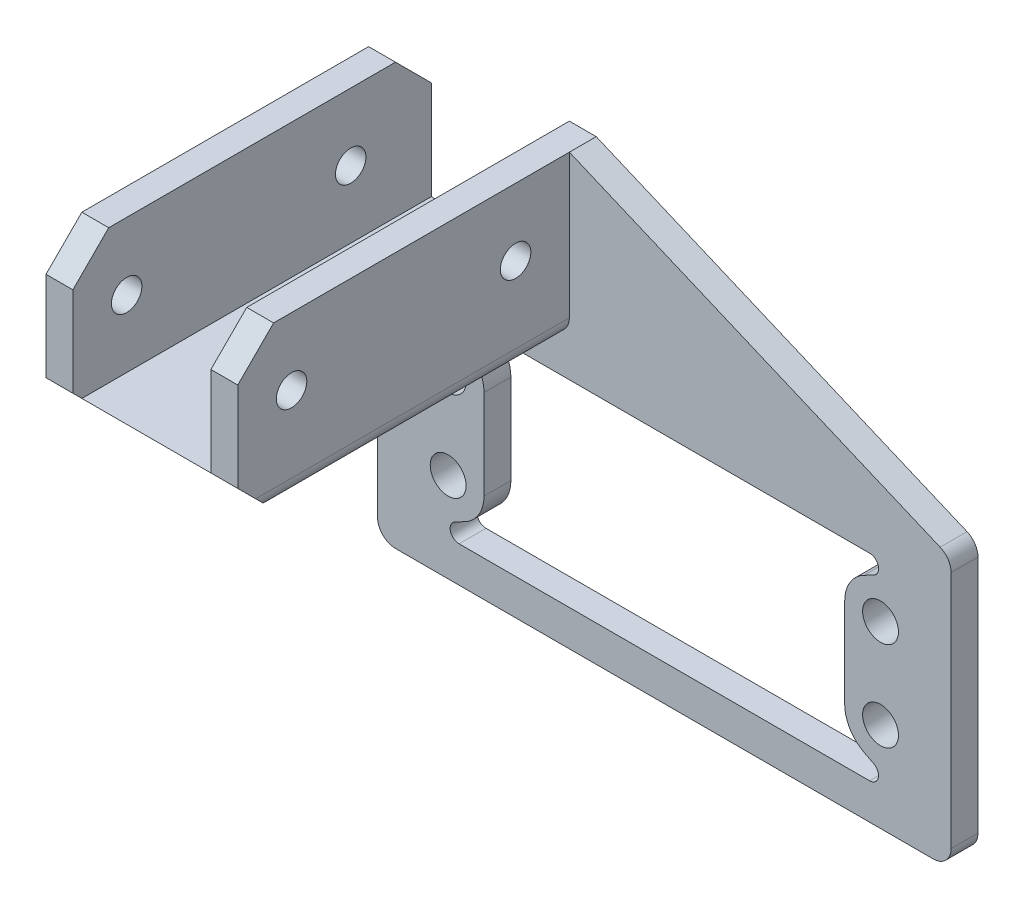
from build123d import *

# Parameters (mm, degrees)
BOSS_EXTRUDE1_DEPTH     = 40
CUT_EXTRUDE1_DEPTH      = 20
CUT_EXTRUDE1_DEPTH_BACK = 20
SKETCH2_R               = 1.7
BOSS_EXTRUDE2_START     = -3
SKETCH4_W               = 64
SKETCH4_H               = 30
SKETCH4_R               = 2
BOSS_EXTRUDE2_DEPTH     = 3
FILLET1_R               = 1
BOSS_EXTRUDE3_START     = -3
BOSS_EXTRUDE3_DEPTH     = 3
FILLET2_R               = 2
BOSS_EXTRUDE4_START     = -2
BOSS_EXTRUDE4_DEPTH     = 2
CHAMFER1_SIZE           = 4
CHAMFER3_SIZE           = 4
FILLET3_R               = 2


with BuildPart() as part:
    # Sketch1 → Boss-Extrude1 (new body)
    with BuildSketch(Plane.XY):
        Polygon((-3, -3), (-3, 15), (0, 15), (0, 0), (15.4, 0), (15.4, 15), (18.4, 15), (18.4, -3), align=None)
    extrude(amount=BOSS_EXTRUDE1_DEPTH)

    # Sketch2 → Cut-Extrude1 (cut, two sides: drawn at the far end of the back side and taken through both)
    with BuildSketch(Plane(origin=(0, 0, 0), x_dir=(0, 0, -1), z_dir=(1, 0, 0)).offset(-CUT_EXTRUDE1_DEPTH_BACK)):
        with Locations(Location((-34, 7.5, 0), (0, 0, 180))):
            Circle(SKETCH2_R)
        with Locations(Location((-9, 7.5, 0), (0, 0, 180))):
            Circle(SKETCH2_R)
    extrude(amount=CUT_EXTRUDE1_DEPTH + CUT_EXTRUDE1_DEPTH_BACK, mode=Mode.SUBTRACT)

    # Sketch4 → Boss-Extrude2 (add)
    with BuildSketch(Plane(origin=(0, 0, 0), x_dir=(-1, 0, 0), z_dir=(0, 0, -1)).offset(BOSS_EXTRUDE2_START)):
        with Locations((-29, -18)):
            Rectangle(SKETCH4_W, SKETCH4_H)
        with Locations((-4.875030798, -23.000128049)):
            Circle(SKETCH4_R, mode=Mode.SUBTRACT)
        with Locations((-4.87501026, -12.999951056)):
            Circle(SKETCH4_R, mode=Mode.SUBTRACT)
        with Locations((-53.124974567, -23.00004902)):
            Circle(SKETCH4_R, mode=Mode.SUBTRACT)
        with Locations((-53.125010259, -12.999787804)):
            Circle(SKETCH4_R, mode=Mode.SUBTRACT)
        with BuildLine():
            Line((-1.999964331, -28.999999992), (-55.999999981, -28.997992053))
            Line((-55.999999981, -28.997992053), (-51.282852208, -26.550624356))
            ThreePointArc((-51.282852208, -26.550624356), (-49.706744703, -25.077476419), (-49.124974567, -23.00004902))
            Line((-49.124974567, -23.00004902), (-49.125010259, -12.999787804))
            ThreePointArc((-49.125010259, -12.999787804), (-49.706039872, -10.923579364), (-51.280331003, -9.450540216))
            Line((-51.280331003, -9.450540216), (-55.999146244, -6.99799207))
            Line((-55.999146244, -6.99799207), (-1.999146282, -7.000000007))
            Line((-1.999146282, -7.000000007), (-6.718065019, -9.449859627))
            ThreePointArc((-6.718065019, -9.449859627), (-8.293505472, -10.922960328), (-8.87501026, -12.999951056))
            Line((-8.87501026, -12.999951056), (-8.875030798, -23.000128049))
            ThreePointArc((-8.875030798, -23.000128049), (-8.293584076, -25.077023205), (-6.718284054, -26.550116421))
            Line((-6.718284054, -26.550116421), (-1.999964331, -28.999999992))
        make_face(mode=Mode.SUBTRACT)
    extrude(amount=BOSS_EXTRUDE2_DEPTH)

    # Fillet1
    fillet1_edges = [part.edges().sort_by_distance(p)[0] for p in [
        (55.999999981, -28.997992053, 1.5),
        (1.999964331, -28.999999992, 1.5),
        (1.999146282, -7.000000007, 1.5),
        (55.999146244, -6.99799207, 1.5),
    ]]
    fillet(fillet1_edges, radius=FILLET1_R)

    # Sketch6 → Boss-Extrude3 (add)
    with BuildSketch(Plane(origin=(0, 0, 0), x_dir=(-1, 0, 0), z_dir=(0, 0, -1)).offset(BOSS_EXTRUDE3_START)):
        Polygon((-18.4, 15), (-61, -3), (-18.4, -3), align=None)
    extrude(amount=BOSS_EXTRUDE3_DEPTH)

    # Fillet2
    fillet2_edges = [part.edges().sort_by_distance(p)[0] for p in [
        (61, -3, 1.5),
        (-3, -33, 1.5),
        (61, -33, 1.5),
    ]]
    fillet(fillet2_edges, radius=FILLET2_R)

    # Sketch7 → Boss-Extrude4 (add)
    with BuildSketch(Plane.ZY.offset(3).offset(BOSS_EXTRUDE4_START)):
        Polygon((3, -17), (14.5, -3), (3, -3), align=None)
    extrude(amount=BOSS_EXTRUDE4_DEPTH)

    # Chamfer1
    # the kernel refuses this chamfer: 4 mm, written as the material it takes off along each edge
    with BuildSketch(Plane(origin=(28.686731952, -3, 40), x_dir=(0, -0.027495876610586403, -0.9996219169112968), z_dir=(-1, 0, 0))) as chamfer1_piece_1:
        Polygon((CHAMFER1_SIZE * 0.999621916911, -CHAMFER1_SIZE * 0.0274958766106), (-CHAMFER1_SIZE * 0.0274958766106, -CHAMFER1_SIZE * 0.999621916911), (0, 0), align=None)
    extrude(amount=41.973463904, mode=Mode.SUBTRACT)

    # Chamfer3
    chamfer3_edges = [part.edges().sort_by_distance(p)[0] for p in [
        (-1.5, 15, 0),
        (16.9, 15, 40),
        (-1.5, 15, 40),
    ]]
    chamfer(chamfer3_edges, length=CHAMFER3_SIZE)

    # Fillet3
    fillet3_edges = [part.edges().sort_by_distance(p)[0] for p in [
        (18.4, -3, 19.5),
    ]]
    fillet(fillet3_edges, radius=FILLET3_R)


solid = part.part
